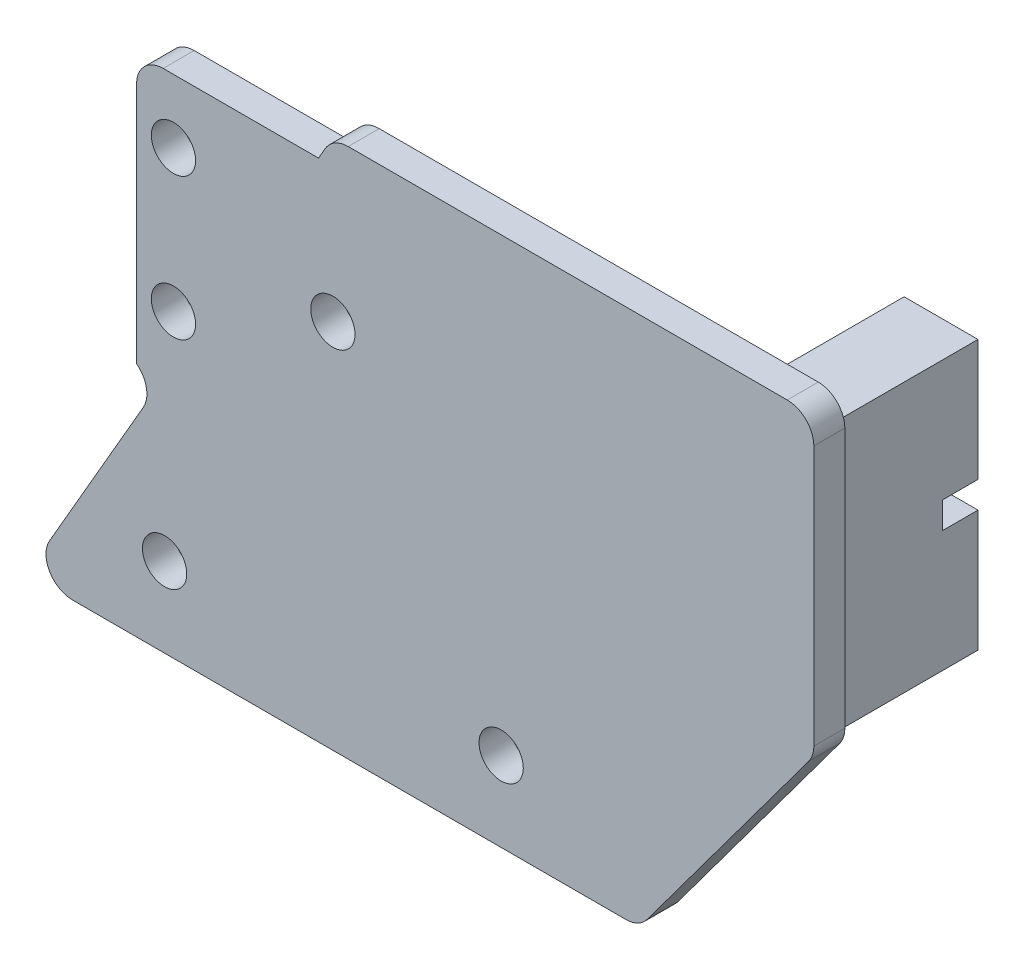
from build123d import *

# Parameters (mm, degrees)
SKETCH1_R           = 2.5
BOSS_EXTRUDE1_DEPTH = 3.5
FILLET1_R           = 3
SKETCH2_W           = 75.5
SKETCH2_H           = 30.382012963
SKETCH2_R           = 4.125
SKETCH2_R_2         = 2.5
BOSS_EXTRUDE2_DEPTH = 3.5
SKETCH2_4_W         = 8.340351234
SKETCH2_4_H         = 13.691006481
SKETCH2_4_R         = 2.5
SKETCH2_4_H_2       = 13.691006482
BOSS_EXTRUDE3_DEPTH = 16
FILLET2_R           = 3
FILLET3_R           = 3
SKETCH2_7_W         = 8.340351234
SKETCH2_7_H         = 3
BOSS_EXTRUDE5_DEPTH = 12


with BuildPart() as part:
    # Sketch1 → Boss-Extrude1 (new body)
    with BuildSketch(Plane.XY):
        Polygon((-32.756938656, -9), (36.41997588, -9), (56.136580269, 17.570938838), (56.136580269, 50.908965344), (1.831518612, 50.908965344), align=None)
        with Locations((-17.168481388, 0)):
            Circle(SKETCH1_R, mode=Mode.SUBTRACT)
        with Locations((20.831518612, 0)):
            Circle(SKETCH1_R, mode=Mode.SUBTRACT)
        with Locations((1.831518612, 32.908965344)):
            Circle(SKETCH1_R, mode=Mode.SUBTRACT)
    extrude(amount=BOSS_EXTRUDE1_DEPTH)

    # Fillet1
    fillet1_edges = [part.edges().sort_by_distance(p)[0] for p in [
        (36.41997588, -9, 1.75),
        (-32.756938656, -9, 1.75),
        (1.831518612, 50.908965344, 1.75),
    ]]
    fillet(fillet1_edges, radius=FILLET1_R)

    # Sketch2 → Boss-Extrude2 (add)
    with BuildSketch(Plane(origin=(0, 0, 0), x_dir=(-1, 0, 0), z_dir=(0, 0, -1))):
        with Locations((-17.421869846, 32.908965344)):
            Rectangle(SKETCH2_W, SKETCH2_H)
        with Locations((-1.831518612, 32.908965344)):
            Circle(SKETCH2_R, mode=Mode.SUBTRACT)
        with Locations((16.168481388, 40.908965344)):
            Circle(SKETCH2_R_2, mode=Mode.SUBTRACT)
        with Locations((16.168481388, 24.908965344)):
            Circle(SKETCH2_R_2, mode=Mode.SUBTRACT)
        with Locations((-50.831518612, 24.908965344)):
            Circle(SKETCH2_R_2, mode=Mode.SUBTRACT)
        with Locations((-50.831518612, 40.908965344)):
            Circle(SKETCH2_R_2, mode=Mode.SUBTRACT)
    extrude(amount=-BOSS_EXTRUDE2_DEPTH)

    # Sketch2<4> → Boss-Extrude3 (add)
    # profile 1 of 2: a face of its own
    with BuildSketch(Plane(origin=(0, 0, 0), x_dir=(-1, 0, 0), z_dir=(0, 0, -1))):
        with Locations((-51.001694229, 41.254468585)):
            Rectangle(SKETCH2_4_W, SKETCH2_4_H)
        with Locations((-50.831518612, 40.908965344)):
            Circle(SKETCH2_4_R, mode=Mode.SUBTRACT)
    # profile 2 of 2: a face of its own
    with BuildSketch(Plane(origin=(0, 0, 0), x_dir=(-1, 0, 0), z_dir=(0, 0, -1))):
        with Locations((-51.001694229, 24.563462103)):
            Rectangle(SKETCH2_4_W, SKETCH2_4_H_2)
        with Locations((-50.831518612, 24.908965344)):
            Circle(SKETCH2_4_R, mode=Mode.SUBTRACT)
    extrude(amount=BOSS_EXTRUDE3_DEPTH)

    # Fillet2
    # the kernel refuses this fillet: 3 mm, written as the material it adds along each edge
    with BuildSketch(Plane(origin=(-17.331317914, 17.717958862, 0), x_dir=(-0.4999999999999997, -0.8660254037844388, 0), z_dir=(0, 0, 1))) as fillet2_piece_1:
        with BuildLine():
            CenterArc((4.470985889, -3), FILLET2_R, 90, 82.247461928)
            Line((1.49840612, -2.59531553), (1.438954525, -2.587221841))
            ThreePointArc((1.438954525, -2.587221841), (0.697241536, -1.327657765), (-0.051961524, -0.03))
            Line((-0.051961524, -0.03), (0, 0.06))
            Line((0, 0.06), (4.470985889, 0.06))
            Line((4.470985889, 0.06), (4.470985889, 0))
        make_face()
    extrude(amount=3.5)

    # Fillet3
    fillet3_edges = [part.edges().sort_by_distance(p)[0] for p in [
        (-20.328130154, 48.099971825, 1.75),
        (56.136580269, 50.908965344, 1.75),
        (56.136580269, 17.570938838, 1.75),
    ]]
    fillet(fillet3_edges, radius=FILLET3_R)

    # Sketch2<7> → Boss-Extrude5 (add)
    with BuildSketch(Plane(origin=(0, 0, 0), x_dir=(-1, 0, 0), z_dir=(0, 0, -1))):
        with Locations((-51.001694229, 32.908965344)):
            Rectangle(SKETCH2_7_W, SKETCH2_7_H)
    extrude(amount=BOSS_EXTRUDE5_DEPTH)


solid = part.part
